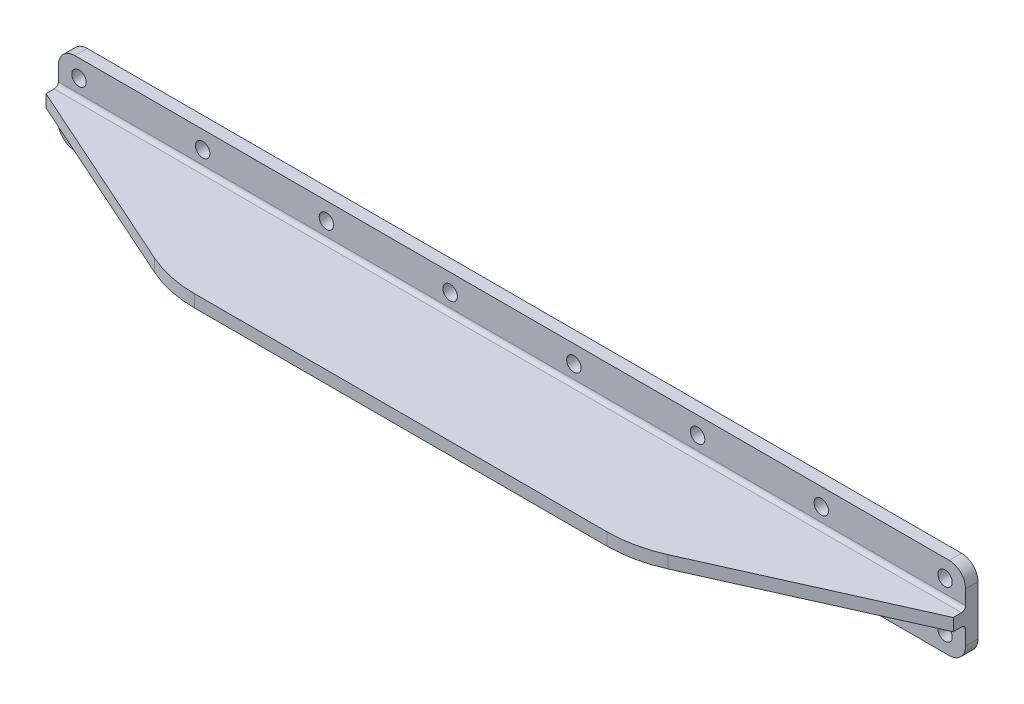
from build123d import *

# Parameters (mm, degrees)
BOSS_EXTRUDE1_DEPTH = 110
SKETCH2_R           = 1.75
CUT_EXTRUDE1_DEPTH  = 115.455231423
CUT_EXTRUDE2_DEPTH  = 116.41771961
FILLET1_R           = 4
FILLET2_R           = 1


with BuildPart() as part:
    # Sketch1 → Boss-Extrude1 (new, symmetric)
    with BuildSketch(Plane(origin=(0, 0, 0), x_dir=(0, 0, -1), z_dir=(1, 0, 0))):
        Polygon((-33, -1.5), (-33, 1.5), (-3, 1.5), (-3, 10), (0, 10), (0, -10), (-3, -10), (-3, -1.5), align=None)
    extrude(amount=BOSS_EXTRUDE1_DEPTH, both=True)

    # Sketch2 → Cut-Extrude1 (cut, through all)
    with BuildSketch(Plane.XY.offset(3)):
        with Locations((-15, -5.75)):
            Circle(SKETCH2_R)
        with Locations((-45, -5.75)):
            Circle(SKETCH2_R)
        with Locations((-75, -5.75)):
            Circle(SKETCH2_R)
        with Locations((-105, -5.75)):
            Circle(SKETCH2_R)
        with Locations((105, -5.75)):
            Circle(SKETCH2_R)
        with Locations((75, -5.75)):
            Circle(SKETCH2_R)
        with Locations((45, -5.75)):
            Circle(SKETCH2_R)
        with Locations((15, -5.75)):
            Circle(SKETCH2_R)
        with Locations((15, 5.75)):
            Circle(SKETCH2_R)
        with Locations((45, 5.75)):
            Circle(SKETCH2_R)
        with Locations((75, 5.75)):
            Circle(SKETCH2_R)
        with Locations((105, 5.75)):
            Circle(SKETCH2_R)
        with Locations((-105, 5.75)):
            Circle(SKETCH2_R)
        with Locations((-75, 5.75)):
            Circle(SKETCH2_R)
        with Locations((-45, 5.75)):
            Circle(SKETCH2_R)
        with Locations((-15, 5.75)):
            Circle(SKETCH2_R)
    extrude(amount=-CUT_EXTRUDE1_DEPTH, mode=Mode.SUBTRACT)

    # Sketch3 → Cut-Extrude2 (cut, through all)
    with BuildSketch(Plane(origin=(0, 1.5, 0), x_dir=(1, 0, 0), z_dir=(0, 1, 0))):
        with BuildLine():
            Line((62.262040232, -27.379597684), (110, -6))
            Line((110, -6), (110, -33))
            Line((110, -33), (-110, -33))
            Line((-110, -33), (-110, -6))
            Line((-110, -6), (-62.262040232, -27.379597684))
            ThreePointArc((-62.262040232, -27.379597684), (-56.269452507, -29.337586221), (-50, -30))
            Line((-50, -30), (50, -30))
            ThreePointArc((50, -30), (56.269452507, -29.337586221), (62.262040232, -27.379597684))
        make_face()
    extrude(amount=-CUT_EXTRUDE2_DEPTH, mode=Mode.SUBTRACT)

    # Fillet1
    fillet1_edges = [part.edges().sort_by_distance(p)[0] for p in [
        (110, 10, 1.5),
        (110, -10, 1.5),
        (-110, -10, 1.5),
        (-110, 10, 1.5),
    ]]
    fillet(fillet1_edges, radius=FILLET1_R)

    # Fillet2
    fillet2_edges = [part.edges().sort_by_distance(p)[0] for p in [
        (0, -1.5, 3),
        (0, 1.5, 3),
    ]]
    fillet(fillet2_edges, radius=FILLET2_R)


solid = part.part
